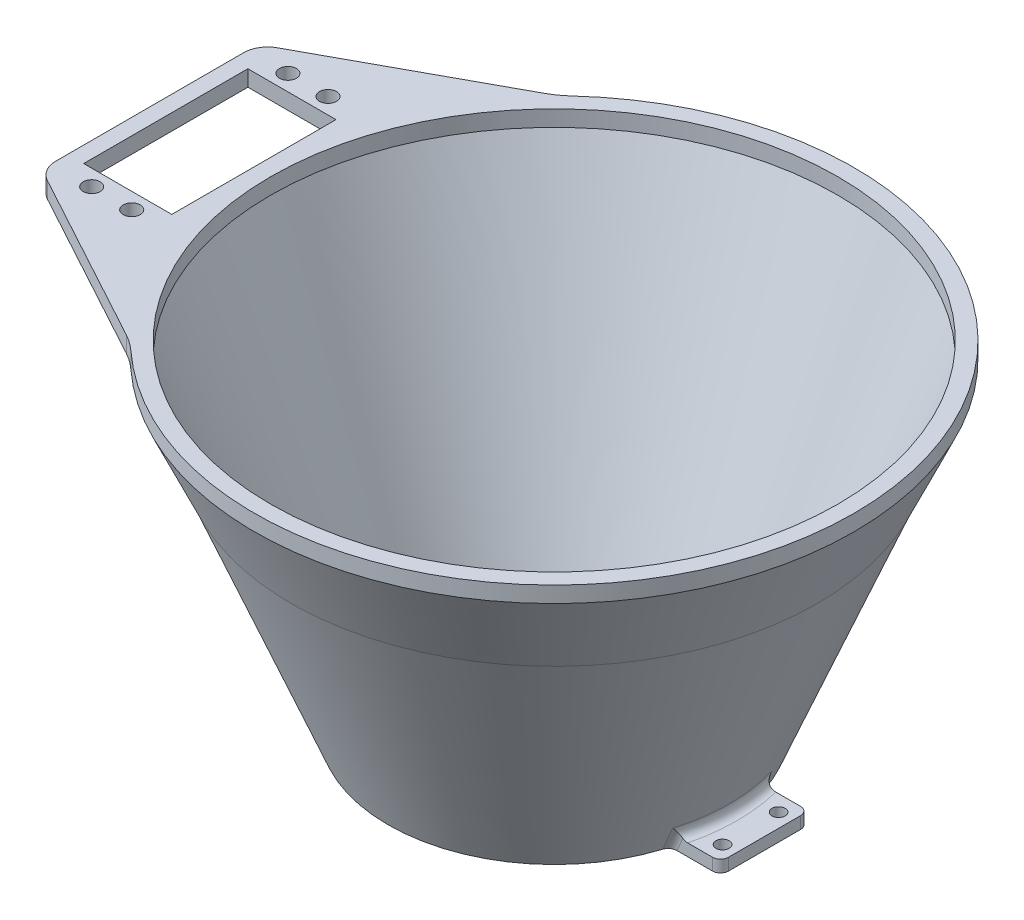
from build123d import *

# Parameters (mm, degrees)
SKETCH3_R           = 1.650000000000002
BOSS_EXTRUDE1_DEPTH = 3
FILLET1_R           = 2
SKETCH4_R           = 2.125000000000003
SKETCH4_W           = 22
SKETCH4_H           = 41
SKETCH4_R_2         = 70.82209806681229
BOSS_EXTRUDE2_DEPTH = 4
BOSS_EXTRUDE3_DEPTH = 4
FILLET4_R           = 20
FILLET5_R           = 6


with BuildPart() as part:
    # Sketch2 → Revolve1 (revolve)
    with BuildSketch(Plane.XY):
        Polygon((38.5, 0), (70.82209806681229, 80), (73.82209806681229, 80), (41.5, 0), align=None)
    revolve(axis=Axis((0, 0, 0), (0, 1, 0)))

    # Sketch3 → Boss-Extrude1 (add)
    # profile 1 of 2: a face of its own
    with BuildSketch(Plane.XZ):
        with BuildLine():
            Line((-52.515621949433694, 11), (-40.0156219494337, 11))
            ThreePointArc((-40.0156219494337, 11), (-41.5, -5.08e-15), (-40.0156219494337, -11))
            Line((-40.0156219494337, -11), (-52.515621949433694, -11))
            Line((-52.515621949433694, -11), (-52.515621949433694, 11))
        make_face()
        with Locations((-49.015621949433694, -7)):
            Circle(SKETCH3_R, mode=Mode.SUBTRACT)
        with Locations((-49.015621949433694, 7)):
            Circle(SKETCH3_R, mode=Mode.SUBTRACT)
    # profile 2 of 2: a face of its own
    with BuildSketch(Plane.XZ):
        with BuildLine():
            Line((52.515621949433694, -11), (40.01562194943381, -11))
            ThreePointArc((40.01562194943381, -11), (41.50000000000011, 0), (40.01562194943381, 11))
            Line((40.01562194943381, 11), (52.515621949433694, 11))
            Line((52.515621949433694, 11), (52.515621949433694, -11))
        make_face()
        with Locations((49.015621949433694, 7)):
            Circle(SKETCH3_R, mode=Mode.SUBTRACT)
        with Locations((49.015621949433694, -7)):
            Circle(SKETCH3_R, mode=Mode.SUBTRACT)
    extrude(amount=-BOSS_EXTRUDE1_DEPTH)

    # Fillet1
    fillet1_edges = [part.edges().sort_by_distance(p)[0] for p in [
        (40.64375151478456, 1.4998820945074982, -11),
        (52.515621949433694, 1.5, -11),
        (52.515621949433694, 1.5, 11),
        (40.64375151478456, 1.4998820945074982, 11),
        (-40.64375151478456, 1.4998820945074982, 11),
        (-52.515621949433694, 1.5, 11),
        (-52.515621949433694, 1.5, -11),
        (-40.64375151478456, 1.4998820945074982, -11),
        (42.35035675064734, 3, -5.546976477894484),
        (-42.71207867750545, 3, 2.42e-14),
    ]]
    fillet(fillet1_edges, radius=FILLET1_R)



with BuildPart() as body_2:
    # Sketch4 → Boss-Extrude2 (new body)
    with BuildSketch(Plane(origin=(0, 80, 0), x_dir=(1, 0, 0), z_dir=(0, 1, 0))):
        with BuildLine():
            Line((-101, 27), (-101, -27))
            Line((-101, -27), (-20, -71.06125641294311))
            ThreePointArc((-19.999999999999993, -71.06125641294312), (73.82209806681227, -3.197e-14), (-19.999999999999936, 71.06125641294314))
            Line((-19.999999999999993, 71.06125641294311), (-101, 27))
        make_face()
        with Locations((-91, -24.5)):
            Circle(SKETCH4_R, mode=Mode.SUBTRACT)
        with Locations((-80.99999999999999, -24.5)):
            Circle(SKETCH4_R, mode=Mode.SUBTRACT)
        with Locations((-85.99999999999999, 7.11e-15)):
            Rectangle(SKETCH4_W, SKETCH4_H, mode=Mode.SUBTRACT)
        with Locations((-91, 24.5)):
            Circle(SKETCH4_R, mode=Mode.SUBTRACT)
        with Locations((-80.99999999999999, 24.5)):
            Circle(SKETCH4_R, mode=Mode.SUBTRACT)
        Circle(SKETCH4_R_2, mode=Mode.SUBTRACT)
    extrude(amount=BOSS_EXTRUDE2_DEPTH)


with BuildPart() as part_1:
    add(part.part)

    add(body_2.part)  # Revolve5 merges body 2
    # Sketch6 → Revolve5 (revolve)
    with BuildSketch(Plane.XY):
        Polygon((-73.82209806681229, 80), (-74.82209806681229, 79.99999999999999), (-65.74157355010921, 59.999999999999986), align=None)
    revolve(axis=Axis((0, 0, 0), (0, 1, 0)))

    # Sketch7 → Boss-Extrude3 (add)
    with BuildSketch(Plane(origin=(0, 80, 0), x_dir=(1, 0, 0), z_dir=(0, 1, 0))):
        with BuildLine():
            Line((-52.33774003336271, 53.47062116078153), (-20.000000000000046, 71.06125641294312))
            ThreePointArc((-20.000000000000046, 71.06125641294312), (73.82209806681229, -1.639e-14), (-20.000000000000078, -71.06125641294311))
            Line((-20.000000000000078, -71.06125641294311), (-52.3377400333627, -53.47062116078154))
            ThreePointArc((-52.3377400333627, -53.47062116078154), (74.82209806681229, 0), (-52.33774003336271, 53.47062116078153))
        make_face()
    extrude(amount=BOSS_EXTRUDE3_DEPTH)

    # Fillet4
    fillet4_edges = [part_1.edges().sort_by_distance(p)[0] for p in [
        (-52.3377400333627, 82, 53.47062116078154),
        (-52.337740033362714, 82, -53.47062116078153),
    ]]
    fillet(fillet4_edges, radius=FILLET4_R)

    # Fillet5
    fillet5_edges = [part_1.edges().sort_by_distance(p)[0] for p in [
        (-101, 82, -27),
        (-101, 82, 27),
    ]]
    fillet(fillet5_edges, radius=FILLET5_R)


solid = part_1.part
